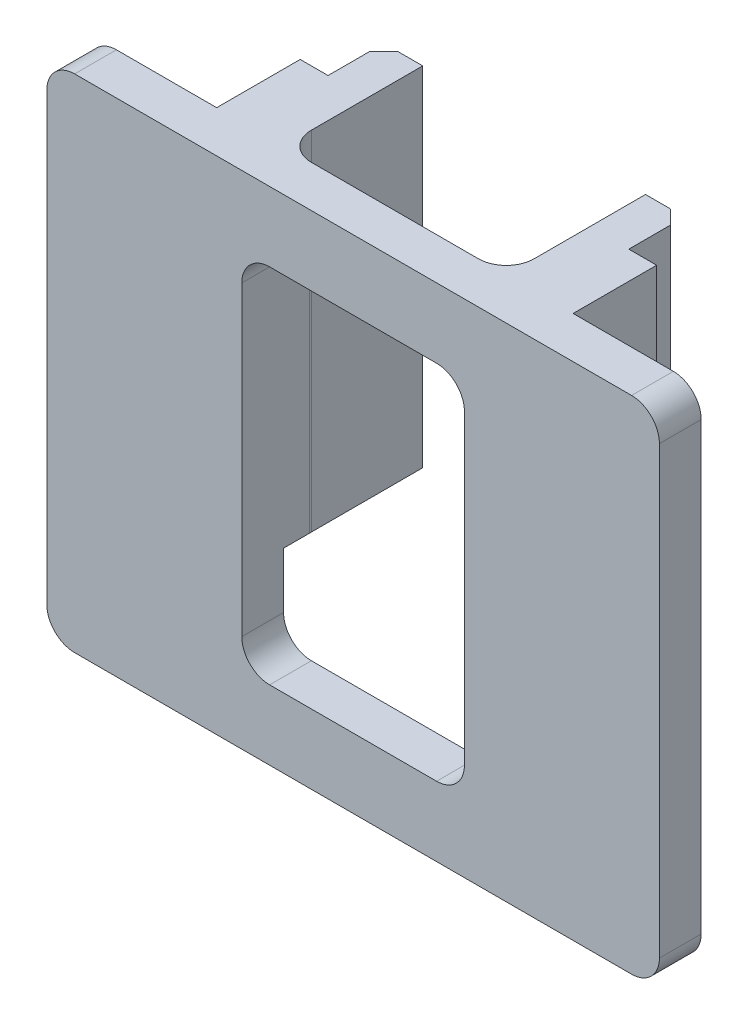
from build123d import *

# Parameters (mm, degrees)
SKETCH_1_W           = 21.6
SKETCH_1_H           = 25
EXTRUDE_1_DEPTH      = 10
SKETCH_2_W           = 44
SKETCH_2_H           = 36
EXTRUDE_2_DEPTH      = 3
EXTRUDE_3_DEPTH      = 2
EXTRUDE_3_DEPTH_BACK = 23.6
SKETCH_3_W           = 6
SKETCH_3_H           = 25
CHAMFER_1_SIZE       = 1
SKETCH_4_W           = 16
SKETCH_4_H           = 25
CUT_EXTRUDE_1_DEPTH  = 10
FILLET_1_R           = 2
SKETCH_5_W           = 15.991126726
SKETCH_5_H           = 26
CUT_EXTRUDE_2_DEPTH  = 34.708307581
FILLET_2_R           = 2
FILLET_START         = 5.4999999
FILLET_3_DEPTH       = 7.0000001
FILLET_START_2       = -12.5
FILLET_3_2_DEPTH     = 18.304364073
FILLET_START_3       = 8
FILLET_3_3_DEPTH     = 2


with BuildPart() as part:
    # ｽｹｯﾁ1 → ﾎﾞｽ - 押し出し1 (new body)
    with BuildSketch(Plane.XY):
        Rectangle(SKETCH_1_W, SKETCH_1_H)
    extrude(amount=EXTRUDE_1_DEPTH)

    # ｽｹｯﾁ2 → ﾎﾞｽ - 押し出し2 (add)
    with BuildSketch(Plane.XY.offset(10)):
        with Locations((0, -5.5)):
            Rectangle(SKETCH_2_W, SKETCH_2_H)
    extrude(amount=EXTRUDE_2_DEPTH)

    # ｽｹｯﾁ3 → ﾎﾞｽ - 押し出し3 (add, two sides: drawn at the far end of the back side and taken through both)
    with BuildSketch(Plane(origin=(10.8, 0, 0), x_dir=(0, 0, -1), z_dir=(1, 0, 0)).offset(-EXTRUDE_3_DEPTH_BACK)):
        with Locations((-7, 0)):
            Rectangle(SKETCH_3_W, SKETCH_3_H)
    extrude(amount=EXTRUDE_3_DEPTH + EXTRUDE_3_DEPTH_BACK)

    # 面取り1
    chamfer_1_edges = [part.edges().sort_by_distance(p)[0] for p in [
        (-10.8, 0, 0),
        (10.8, 0, 0),
    ]]
    chamfer(chamfer_1_edges, length=CHAMFER_1_SIZE)

    # ｽｹｯﾁ4 → ｶｯﾄ - 押し出し1 (cut)
    with BuildSketch(Plane(origin=(0, 0, 0), x_dir=(-1, 0, 0), z_dir=(0, 0, -1))):
        Rectangle(SKETCH_4_W, SKETCH_4_H)
    extrude(amount=-CUT_EXTRUDE_1_DEPTH, mode=Mode.SUBTRACT)

    # ﾌｨﾚｯﾄ1
    fillet_1_edges = [part.edges().sort_by_distance(p)[0] for p in [
        (22, -23.5, 11.5),
        (22, 12.5, 11.5),
        (-22, 12.5, 11.5),
        (-22, -23.5, 11.5),
    ]]
    fillet(fillet_1_edges, radius=FILLET_1_R)

    # ｽｹｯﾁ5 → ｶｯﾄ - 押し出し2 (cut, through all)
    with BuildSketch(Plane(origin=(0, 0, 10), x_dir=(-1, 0, 0), z_dir=(0, 0, -1))):
        with Locations((0, -5.5)):
            Rectangle(SKETCH_5_W, SKETCH_5_H)
    extrude(amount=-CUT_EXTRUDE_2_DEPTH, mode=Mode.SUBTRACT)

    # ﾌｨﾚｯﾄ2
    fillet_2_edges = [part.edges().sort_by_distance(p)[0] for p in [
        (-7.995563363, 7.5, 11.5),
        (-7.995563363, -18.5, 11.5),
        (7.995563363, -18.5, 11.5),
        (7.995563363, 7.5, 11.5),
    ]]
    fillet(fillet_2_edges, radius=FILLET_2_R)

    # ﾌｨﾚｯﾄ3: read off the stored shape, not the designer's step
    # ﾌｨﾚｯﾄ3 outline → ﾌｨﾚｯﾄ3 (add)
    with BuildSketch(Plane(origin=(0, 0, 0), x_dir=(1, 0, 0), z_dir=(0, 1, 0)).offset(FILLET_START)):
        with BuildLine():
            ThreePointArc((-6, -10), (-7.414213562, -9.414213562), (-8, -8))
            Line((-8, -8), (-8, -10))
            Line((-8, -10), (-6, -10))
        make_face()
        with BuildLine():
            Line((6, -10), (8, -10))
            Line((8, -10), (8, -8))
            ThreePointArc((8, -8), (7.414213562, -9.414213562), (6, -10))
        make_face()
    extrude(amount=FILLET_3_DEPTH)

    # Fillet 3 2 outline → Fillet 3 2 (add)
    with BuildSketch(Plane(origin=(0, 0, 0), x_dir=(1, 0, 0), z_dir=(0, 1, 0)).offset(FILLET_START_2)):
        with BuildLine():
            Line((-7.995563363, -10), (-7.995563363, -8.133142264))
            ThreePointArc((-7.995563363, -8.133142264), (-7.998890533, -8.066608082), (-8, -8))
            Line((-8, -8), (-8, -10))
            Line((-8, -10), (-7.995563363, -10))
        make_face()
        with BuildLine():
            ThreePointArc((8, -8), (7.998890533, -8.066608082), (7.995563363, -8.133142264))
            Line((7.995563363, -8.133142264), (7.995563363, -10))
            Line((7.995563363, -10), (8, -10))
            Line((8, -10), (8, -8))
        make_face()
    extrude(amount=FILLET_3_2_DEPTH)

    # Fillet 3 3 outline → Fillet 3 3 (cut)
    with BuildSketch(Plane.XY.offset(FILLET_START_3)):
        with BuildLine():
            Line((5.995563363, 7.5), (-5.995563363, 7.5))
            ThreePointArc((-5.995563363, 7.5), (-7.409776925, 6.914213563), (-7.995563363, 5.5))
            Line((-7.995563363, 5.5), (7.995563363, 5.5))
            ThreePointArc((7.995563363, 5.5), (7.409776925, 6.914213563), (5.995563363, 7.5))
        make_face()
    extrude(amount=FILLET_3_3_DEPTH, mode=Mode.SUBTRACT)


solid = part.part
